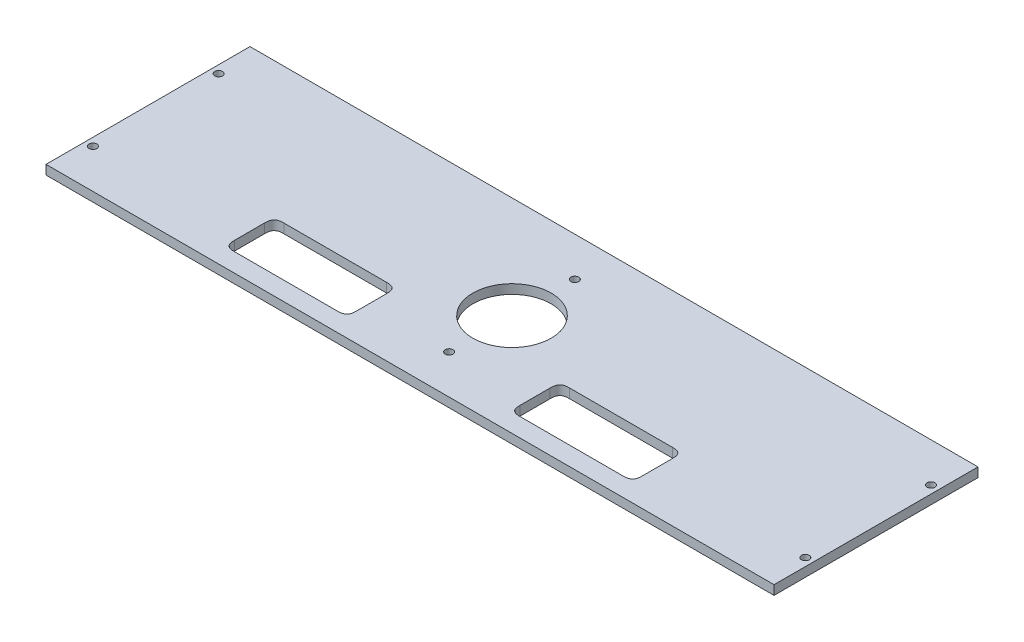
from build123d import *

# Parameters (mm, degrees)
SKETCH1_W           = 372
SKETCH1_H           = 104.22
BOSS_EXTRUDE1_DEPTH = 4.7625
SKETCH2_R           = 2
CUT_EXTRUDE1_DEPTH  = 10
SKETCH3_R           = 2
CUT_EXTRUDE2_DEPTH  = 10
CUT_EXTRUDE3_DEPTH  = 26
SKETCH5_W           = 62.455838456
SKETCH5_H           = 25.297024562
CUT_EXTRUDE4_DEPTH  = 10
FILLET2_SIZE        = 5


with BuildPart() as part:
    # Sketch1 → Boss-Extrude1 (new body)
    with BuildSketch(Plane(origin=(0, 0, 0), x_dir=(1, 0, 0), z_dir=(0, 1, 0))):
        with Locations((72.169818201, 7.186191072)):
            Rectangle(SKETCH1_W, SKETCH1_H)
    extrude(amount=BOSS_EXTRUDE1_DEPTH)

    # Sketch2 → Cut-Extrude1 (cut)
    with BuildSketch(Plane(origin=(0, 4.7625, 0), x_dir=(1, 0, 0), z_dir=(0, 1, 0))):
        with BuildLine():
            ThreePointArc((-107.830181799, 39.296191072), (-108.415968237, 40.710404634), (-109.830181799, 41.296191072))
            Line((-109.830181799, 41.296191072), (-109.830181799, 39.296191072))
            Line((-109.830181799, 39.296191072), (-111.830181799, 39.296191072))
            ThreePointArc((-111.830181799, 39.296191072), (-109.830181799, 37.296191072), (-107.830181799, 39.296191072))
        make_face()
        with BuildLine():
            Line((-109.830181799, 39.296191072), (-109.830181799, 41.296191072))
            ThreePointArc((-109.830181799, 41.296191072), (-111.244395361, 40.710404634), (-111.830181799, 39.296191072))
            Line((-111.830181799, 39.296191072), (-109.830181799, 39.296191072))
        make_face()
        with BuildLine():
            ThreePointArc((256.169818201, 39.296191072), (255.584031763, 40.710404634), (254.169818201, 41.296191072))
            Line((254.169818201, 41.296191072), (254.169818201, 39.296191072))
            Line((254.169818201, 39.296191072), (256.169818201, 39.296191072))
        make_face()
        with BuildLine():
            Line((254.169818201, 39.296191072), (254.169818201, 41.296191072))
            ThreePointArc((254.169818201, 41.296191072), (252.755604639, 37.88197751), (256.169818201, 39.296191072))
            Line((256.169818201, 39.296191072), (254.169818201, 39.296191072))
        make_face()
        with Locations(Location((-109.830181799, -24.923808928, 0), (0, 0, 270))):
            Circle(SKETCH2_R)
        with Locations(Location((254.169818201, -24.923808928, 0), (0, 0, 270))):
            Circle(SKETCH2_R)
    extrude(amount=-CUT_EXTRUDE1_DEPTH, mode=Mode.SUBTRACT)

    # Sketch3 → Cut-Extrude2 (cut)
    with BuildSketch(Plane(origin=(0, 4.7625, 0), x_dir=(1, 0, 0), z_dir=(0, 1, 0))):
        with Locations(Location((72.169818201, 39.296191072, 0), (0, 0, 270))):
            Circle(SKETCH3_R)
        with Locations(Location((72.169818201, -24.923808928, 0), (0, 0, 270))):
            Circle(SKETCH3_R)
    extrude(amount=-CUT_EXTRUDE2_DEPTH, mode=Mode.SUBTRACT)

    # Sketch4 → Cut-Extrude3 (cut)
    with BuildSketch(Plane(origin=(0, 4.7625, 0), x_dir=(1, 0, 0), z_dir=(0, 1, 0))):
        with BuildLine():
            ThreePointArc((92.169818201, 7.186191072), (86.311953825, 21.328326696), (72.169818201, 27.186191072))
            Line((72.169818201, 27.186191072), (72.169818201, -12.813808928))
            ThreePointArc((72.169818201, -12.813808928), (86.311953825, -6.955944552), (92.169818201, 7.186191072))
        make_face()
        with BuildLine():
            Line((72.169818201, -12.813808928), (72.169818201, 27.186191072))
            ThreePointArc((72.169818201, 27.186191072), (52.169818201, 7.186191072), (72.169818201, -12.813808928))
        make_face()
    extrude(amount=-CUT_EXTRUDE3_DEPTH, mode=Mode.SUBTRACT)

    # Sketch5 → Cut-Extrude4 (cut)
    with BuildSketch(Plane(origin=(0, 4.7625, 0), x_dir=(1, 0, 0), z_dir=(0, 1, 0))):
        with Locations((-0.819204667, -22.766901993)):
            Rectangle(SKETCH5_W, SKETCH5_H)
        with Locations((145.158841069, -22.766901993)):
            Rectangle(SKETCH5_W, SKETCH5_H)
    extrude(amount=-CUT_EXTRUDE4_DEPTH, mode=Mode.SUBTRACT)

    # Fillet2
    # a fillet whose section is not a circle: 5 mm, written as the material it adds along each edge
    with BuildSketch(Plane(origin=(176.386760297, 4.7625, 35.415414274), x_dir=(0, 0, -1), z_dir=(0, -1, 0)), Plane(origin=(113.930921841, 4.7625, 10.118389712), x_dir=(0, 0, 1), z_dir=(0, -1, 0)), Plane(origin=(113.930921841, 4.7625, 35.415414274), x_dir=(1, 0, 0), z_dir=(0, -1, 0)), Plane(origin=(30.408714561, 4.7625, 35.415414274), x_dir=(0, 0, -1), z_dir=(0, -1, 0)), Plane(origin=(30.408714561, 4.7625, 10.118389712), x_dir=(-1, 0, 0), z_dir=(0, -1, 0)), Plane(origin=(-32.047123895, 4.7625, 35.415414274), x_dir=(1, 0, 0), z_dir=(0, -1, 0))) as fillet2_piece_1:
        with BuildLine():
            add(Edge.make_bspline([(FILLET2_SIZE, 0), (FILLET2_SIZE * 0.831801948466, 0), (FILLET2_SIZE * 0.663603896932, 0), (FILLET2_SIZE * 0.292893218813, -FILLET2_SIZE * 0.0716919198361), (FILLET2_SIZE * 0.0716919198361, -FILLET2_SIZE * 0.292893218813), (0, -FILLET2_SIZE * 0.663603896932), (0, -FILLET2_SIZE * 0.831801948466), (0, -FILLET2_SIZE)], knots=[0, 0, 0, 0, 0, 0, 0.5, 0.5, 1, 1, 1, 1, 1, 1], degree=5))
            Line((0, -FILLET2_SIZE), (-FILLET2_SIZE * 0.02, -FILLET2_SIZE))
            Line((-FILLET2_SIZE * 0.02, -FILLET2_SIZE), (-FILLET2_SIZE * 0.02, FILLET2_SIZE * 0.02))
            Line((-FILLET2_SIZE * 0.02, FILLET2_SIZE * 0.02), (FILLET2_SIZE, FILLET2_SIZE * 0.02))
            Line((FILLET2_SIZE, FILLET2_SIZE * 0.02), (FILLET2_SIZE, 0))
        make_face()
    extrude(amount=4.7625)
    with BuildSketch(Plane(origin=(176.386760297, 4.7625, 10.118389712), x_dir=(0, 0, 1), z_dir=(0, -1, 0)), Plane(origin=(-32.047123895, 4.7625, 10.118389712), x_dir=(1, 0, 0), z_dir=(0, -1, 0))) as fillet2_piece_2:
        with BuildLine():
            add(Edge.make_bspline([(FILLET2_SIZE, 0), (FILLET2_SIZE * 0.831801948466, 0), (FILLET2_SIZE * 0.663603896932, 0), (FILLET2_SIZE * 0.292893218813, FILLET2_SIZE * 0.0716919198361), (FILLET2_SIZE * 0.0716919198361, FILLET2_SIZE * 0.292893218813), (0, FILLET2_SIZE * 0.663603896932), (0, FILLET2_SIZE * 0.831801948466), (0, FILLET2_SIZE)], knots=[0, 0, 0, 0, 0, 0, 0.5, 0.5, 1, 1, 1, 1, 1, 1], degree=5))
            Line((0, FILLET2_SIZE), (-FILLET2_SIZE * 0.02, FILLET2_SIZE))
            Line((-FILLET2_SIZE * 0.02, FILLET2_SIZE), (-FILLET2_SIZE * 0.02, -FILLET2_SIZE * 0.02))
            Line((-FILLET2_SIZE * 0.02, -FILLET2_SIZE * 0.02), (FILLET2_SIZE, -FILLET2_SIZE * 0.02))
            Line((FILLET2_SIZE, -FILLET2_SIZE * 0.02), (FILLET2_SIZE, 0))
        make_face()
    extrude(amount=4.7625)


solid = part.part
